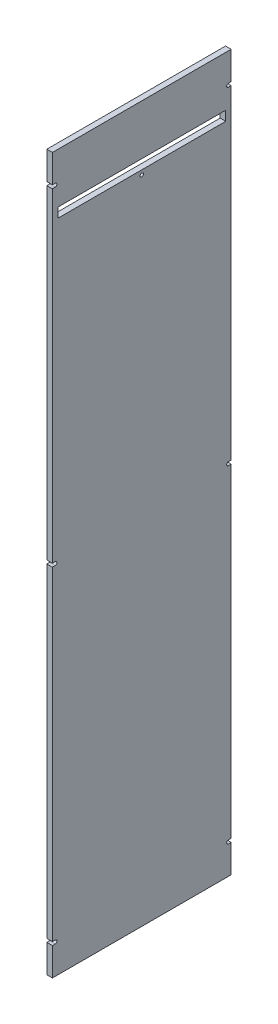
from build123d import *

# Parameters (mm, degrees)
SKETCH1_W             = 4.7625
SKETCH1_H             = 152.4
BOSS_EXTRUDE1_DEPTH   = 609.6
SKETCH2_W             = 142.875
SKETCH2_H             = 7.9375
CUT_EXTRUDE1_DEPTH    = 629.379345146
F_4_CLEARANCE_HOLE1_D = 2.9464
CUT_EXTRUDE2_DEPTH    = 629.379345146
SKETCH13_W            = 143.129
SKETCH13_H            = 8.1915
SKETCH13_W_2          = 142.875
SKETCH13_H_2          = 7.9375
CUT_EXTRUDE3_DEPTH    = 629.379345146


with BuildPart() as part:
    # Sketch1 → Boss-Extrude1 (new body)
    with BuildSketch(Plane(origin=(0, 0, 0), x_dir=(1, 0, 0), z_dir=(0, 1, 0))):
        with Locations((2.38125, 76.2)):
            Rectangle(SKETCH1_W, SKETCH1_H)
    extrude(amount=BOSS_EXTRUDE1_DEPTH)

    # Sketch2 → Cut-Extrude1 (cut, through all)
    with BuildSketch(Plane(origin=(4.7625, 0, 0), x_dir=(0, 0, -1), z_dir=(1, 0, 0))):
        with Locations((76.2, 562.76875)):
            Rectangle(SKETCH2_W, SKETCH2_H)
    extrude(amount=-CUT_EXTRUDE1_DEPTH, mode=Mode.SUBTRACT)

    # #4 Clearance Hole1 (through all)
    with Locations(Plane(origin=(4.7625, 0, 0), x_dir=(0, 0, -1), z_dir=(1, 0, 0))):
        with Locations((76.2, 554.83125)):
            Hole(F_4_CLEARANCE_HOLE1_D / 2)

    # Sketch12 → Cut-Extrude2 (cut, through all)
    with BuildSketch(Plane(origin=(4.7625, 0, 0), x_dir=(0, 0, -1), z_dir=(1, 0, 0))):
        with BuildLine():
            Line((150.01875, 23.9395), (152.4, 23.9395))
            Line((152.4, 23.9395), (152.4, 26.8605))
            Line((152.4, 26.8605), (150.01875, 26.8605))
            ThreePointArc((150.01875, 26.8605), (148.55825, 25.4), (150.01875, 23.9395))
        make_face()
        with BuildLine():
            Line((2.38125, 23.9395), (0, 23.9395))
            Line((0, 23.9395), (0, 26.8605))
            Line((0, 26.8605), (2.38125, 26.8605))
            ThreePointArc((2.38125, 26.8605), (3.84175, 25.4), (2.38125, 23.9395))
        make_face()
        with BuildLine():
            Line((0, 303.3395), (0, 306.2605))
            Line((0, 306.2605), (2.38125, 306.2605))
            ThreePointArc((2.38125, 306.2605), (3.84175, 304.8), (2.38125, 303.3395))
            Line((2.38125, 303.3395), (0, 303.3395))
        make_face()
        with BuildLine():
            Line((152.4, 303.3395), (152.4, 306.2605))
            Line((152.4, 306.2605), (150.01875, 306.2605))
            ThreePointArc((150.01875, 306.2605), (148.55825, 304.8), (150.01875, 303.3395))
            Line((150.01875, 303.3395), (152.4, 303.3395))
        make_face()
        with BuildLine():
            Line((0, 582.7395), (0, 585.6605))
            Line((0, 585.6605), (2.38125, 585.6605))
            ThreePointArc((2.38125, 585.6605), (3.84175, 584.2), (2.38125, 582.7395))
            Line((2.38125, 582.7395), (0, 582.7395))
        make_face()
        with BuildLine():
            Line((152.4, 582.7395), (152.4, 585.6605))
            Line((152.4, 585.6605), (150.01875, 585.6605))
            ThreePointArc((150.01875, 585.6605), (148.55825, 584.2), (150.01875, 582.7395))
            Line((150.01875, 582.7395), (152.4, 582.7395))
        make_face()
    extrude(amount=-CUT_EXTRUDE2_DEPTH, mode=Mode.SUBTRACT)

    # Sketch13 → Cut-Extrude3 (cut, through all)
    with BuildSketch(Plane(origin=(4.7625, 0, 0), x_dir=(0, 0, -1), z_dir=(1, 0, 0))):
        with Locations((76.2, 562.76875)):
            Rectangle(SKETCH13_W, SKETCH13_H)
        with Locations((76.2, 562.76875)):
            Rectangle(SKETCH13_W_2, SKETCH13_H_2, mode=Mode.SUBTRACT)
    extrude(amount=-CUT_EXTRUDE3_DEPTH, mode=Mode.SUBTRACT)


solid = part.part
